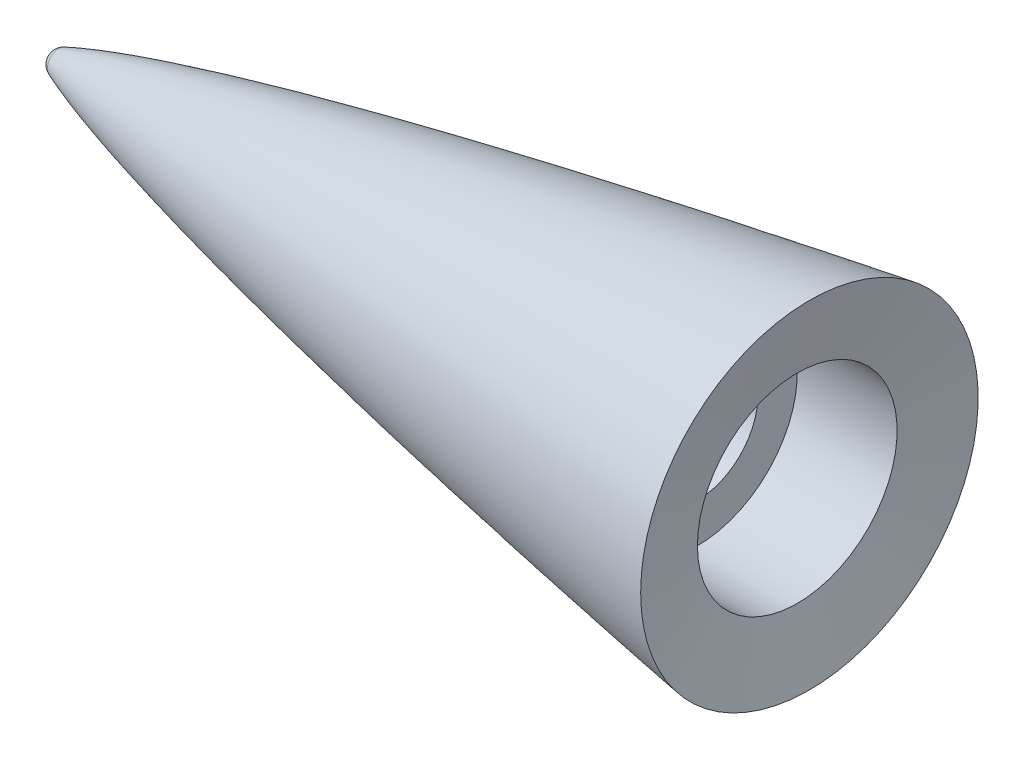
from build123d import *


with BuildPart() as part:
    # Sketch1 → Revolve2 (revolve)
    with BuildSketch(Plane(origin=(0, 0, 0), x_dir=(1, 0, 0), z_dir=(0, 1, 0))):
        with BuildLine():
            Line((1.697321091, 0), (45.819405393, 0))
            Line((45.819405393, 0), (58.519405393, 7.68858))
            Line((58.519405393, 7.68858), (83.919405393, 7.68858))
            Line((83.919405393, 7.68858), (83.919405393, 12.7))
            Line((83.919405393, 12.7), (96.619405393, 12.7))
            Line((96.619405393, 12.7), (98.165428581, 21.4679332))
            add(Edge.make_bspline(
                [(2.682127148, 1.468644362), (2.982092127, 1.591742283), (3.982765764, 1.986976913), (6.075542743, 2.735585346), (9.959285205, 3.961402854), (15.35260807, 5.458934046), (21.847317263, 7.086678944), (29.055363889, 8.749177841), (36.286920774, 10.313744718), (43.531901048, 11.801111844), (50.793776988, 13.226984496), (58.058153921, 14.599266319), (64.433980883, 15.762645369), (69.883896781, 16.732062359), (74.459068804, 17.529825957), (78.065425347, 18.150661812), (81.784961377, 18.781283529), (85.307065103, 19.372441088), (89.168740248, 20.010357493), (92.45838759, 20.54964543), (95.664328261, 21.067043036), (97.333372349, 21.334925019), (98.164963492, 21.467858845), (98.165428581, 21.4679332)],
                knots=[0.027847292, 0.027847292, 0.027847292, 0.027847292, 0.027847292, 0.039565322, 0.06672611, 0.108155752, 0.174993972, 0.2418322, 0.308670423, 0.375508647, 0.442346873, 0.509185099, 0.576023325, 0.642861549, 0.676280662, 0.709699776, 0.743118888, 0.776538001, 0.809957114, 0.843376227, 0.87679534, 0.910214452, 0.910233153, 0.910233153, 0.910233153, 0.910233153, 0.910233153], degree=4))
            ThreePointArc((2.682127148, 1.468644362), (1.966311917, 0.884132234), (1.697321091, 0))
        make_face()
    revolve(axis=Axis((0, 0, 0), (1, 0, 0)))


solid = part.part
